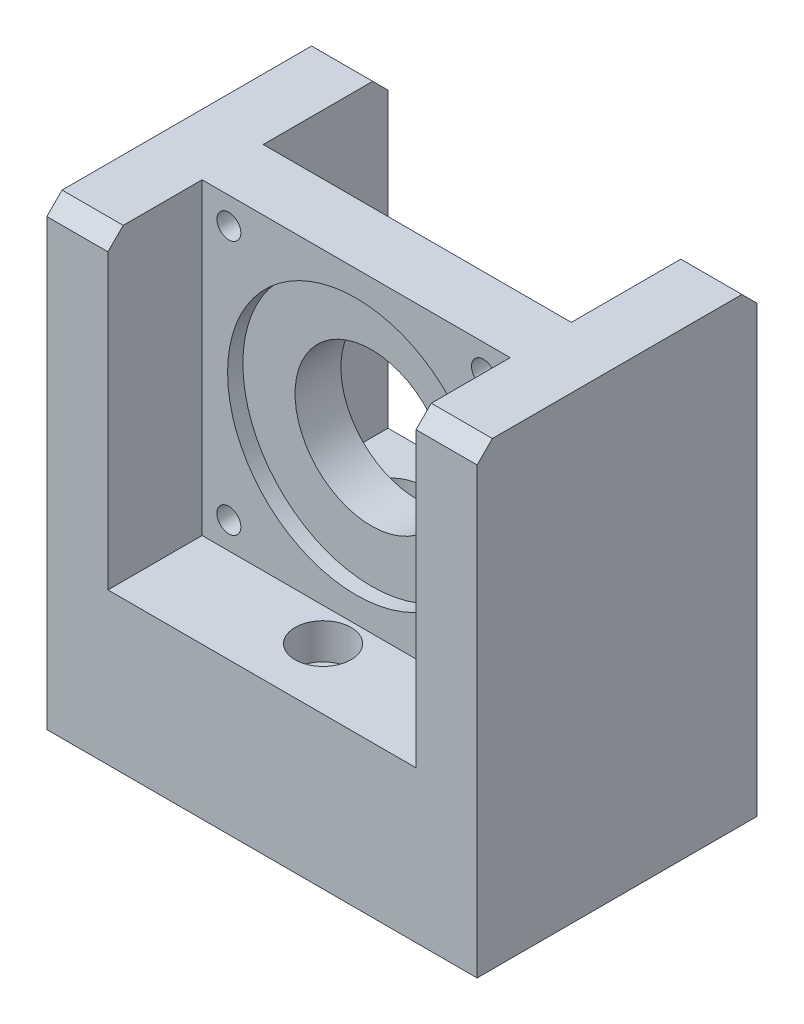
from build123d import *

# Parameters (mm, degrees)
SKETCH1_W           = 60.5
SKETCH1_H           = 60.5
SKETCH1_R           = 15
SKETCH1_R_2         = 2.35
BOSS_EXTRUDE1_DEPTH = 6
SKETCH2_R           = 25.25
CUT_EXTRUDE1_DEPTH  = 3
SKETCH3_W           = 84.5
SKETCH3_H           = 55
BOSS_EXTRUDE2_DEPTH = 29.75
SKETCH4_W           = 55
SKETCH4_H           = 60.5
BOSS_EXTRUDE3_DEPTH = 12
SKETCH5_W           = 55
SKETCH5_H           = 60.5
BOSS_EXTRUDE4_DEPTH = 12
CHAMFER1_SIZE       = 3
SKETCH6_R           = 3.05
CUT_EXTRUDE2_DEPTH  = 80.847119547
SKETCH7_R           = 5.5
CUT_EXTRUDE3_DEPTH  = 7


with BuildPart() as part:
    # Sketch1 → Boss-Extrude1 (new, symmetric)
    with BuildSketch(Plane.XY):
        Rectangle(SKETCH1_W, SKETCH1_H)
        Circle(SKETCH1_R, mode=Mode.SUBTRACT)
        with Locations((-25, 25)):
            Circle(SKETCH1_R_2, mode=Mode.SUBTRACT)
        with Locations((25, 25)):
            Circle(SKETCH1_R_2, mode=Mode.SUBTRACT)
        with Locations((25, -25)):
            Circle(SKETCH1_R_2, mode=Mode.SUBTRACT)
        with Locations((-25, -25)):
            Circle(SKETCH1_R_2, mode=Mode.SUBTRACT)
    extrude(amount=BOSS_EXTRUDE1_DEPTH, both=True)

    # Sketch2 → Cut-Extrude1 (cut)
    with BuildSketch(Plane.XY.offset(6)):
        Circle(SKETCH2_R)
    extrude(amount=-CUT_EXTRUDE1_DEPTH, mode=Mode.SUBTRACT)

    # Sketch3 → Boss-Extrude2 (add)
    with BuildSketch(Plane.XZ.offset(30.25)):
        with Locations((0, -3)):
            Rectangle(SKETCH3_W, SKETCH3_H)
    extrude(amount=BOSS_EXTRUDE2_DEPTH)

    # Sketch4 → Boss-Extrude3 (add)
    with BuildSketch(Plane(origin=(30.25, 0, 0), x_dir=(0, 0, -1), z_dir=(1, 0, 0))):
        with Locations((3, 0)):
            Rectangle(SKETCH4_W, SKETCH4_H)
    extrude(amount=BOSS_EXTRUDE3_DEPTH)

    # Sketch5 → Boss-Extrude4 (add)
    with BuildSketch(Plane.ZY.offset(30.25)):
        with Locations((-3, 0)):
            Rectangle(SKETCH5_W, SKETCH5_H)
    extrude(amount=BOSS_EXTRUDE4_DEPTH)

    # Chamfer1
    chamfer1_edges = [part.edges().sort_by_distance(p)[0] for p in [
        (-36.25, 30.25, -30.5),
        (36.25, 30.25, -30.5),
        (36.25, 30.25, 24.5),
        (-36.25, 30.25, 24.5),
    ]]
    chamfer(chamfer1_edges, length=CHAMFER1_SIZE)

    # Sketch6 → Cut-Extrude2 (cut, through all)
    with BuildSketch(Plane(origin=(0, -30.25, 0), x_dir=(1, 0, 0), z_dir=(0, 1, 0))):
        with Locations((0, -12.5)):
            Circle(SKETCH6_R)
        with Locations((-17.5, 18.5)):
            Circle(SKETCH6_R)
        with Locations((17.5, 18.5)):
            Circle(SKETCH6_R)
    extrude(amount=-CUT_EXTRUDE2_DEPTH, mode=Mode.SUBTRACT)

    # Sketch7 → Cut-Extrude3 (cut)
    with BuildSketch(Plane(origin=(0, -30.25, 0), x_dir=(1, 0, 0), z_dir=(0, 1, 0))):
        with Locations((-17.5, 18.5)):
            Circle(SKETCH7_R)
        with Locations((17.5, 18.5)):
            Circle(SKETCH7_R)
        with Locations((0, -12.5)):
            Circle(SKETCH7_R)
    extrude(amount=-CUT_EXTRUDE3_DEPTH, mode=Mode.SUBTRACT)


solid = part.part
